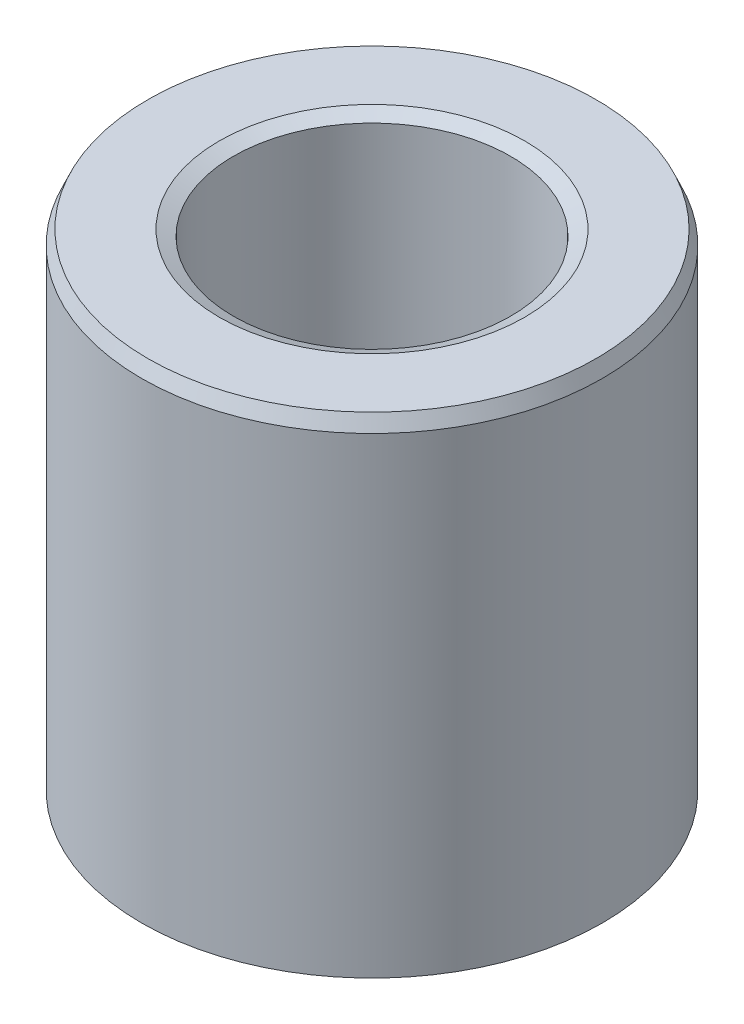
from build123d import *
from OCP.BRepFilletAPI import BRepFilletAPI_MakeChamfer

# Parameters (mm, degrees)
SKETCH1_R           = 32.5
BOSS_EXTRUDE1_DEPTH = 69.383300286
SKETCH2_R           = 19.549536357
CUT_EXTRUDE1_DEPTH  = 84.225851504
CHAMFER1_SIZE       = 1.992995294
CHAMFER1_SIZE2      = 0.874840454


with BuildPart() as part:
    # Sketch1 → Boss-Extrude1 (new body)
    with BuildSketch(Plane(origin=(0, 0, 0), x_dir=(1, 0, 0), z_dir=(0, 1, 0))):
        Circle(SKETCH1_R)
    extrude(amount=BOSS_EXTRUDE1_DEPTH)

    # Sketch2 → Cut-Extrude1 (cut, through all)
    with BuildSketch(Plane(origin=(0, 0, 0), x_dir=(1, 0, 0), z_dir=(0, 1, 0))):
        Circle(SKETCH2_R)
    extrude(amount=CUT_EXTRUDE1_DEPTH, mode=Mode.SUBTRACT)

    # Chamfer1: one chamfer whose edges measure the first distance from different faces: ONE call of the kernel's chamfer builder (chamfer() names one face for all edges)
    chamfer1_edges_1 = [part.edges().sort_by_distance(p)[0] for p in [
        (-19.549536357, 69.383300286, 0),
    ]]
    chamfer1_side_1 = [part.faces().sort_by_distance(p)[0] for p in [
        (-31.580761184, 69.383300286, 0),
    ]]
    chamfer1_edges_2 = [part.edges().sort_by_distance(p)[0] for p in [
        (-19.549536357, 0, 0),
    ]]
    chamfer1_side_2 = [part.faces().sort_by_distance(p)[0] for p in [
        (-19.549536357, 34.691650143, 0),
    ]]
    chamfer1_edges_3 = [part.edges().sort_by_distance(p)[0] for p in [
        (-32.5, 0, 0),
    ]]
    chamfer1_side_3 = [part.faces().sort_by_distance(p)[0] for p in [
        (-31.580761184, 0, 0),
    ]]
    chamfer1_edges_4 = [part.edges().sort_by_distance(p)[0] for p in [
        (-32.5, 69.383300286, 0),
    ]]
    chamfer1_side_4 = [part.faces().sort_by_distance(p)[0] for p in [
        (-32.5, 34.691650143, 0),
    ]]
    chamfer1 = BRepFilletAPI_MakeChamfer(part.part.solid().wrapped)
    for e in chamfer1_edges_1:
        chamfer1.Add(CHAMFER1_SIZE, CHAMFER1_SIZE2, e.wrapped, chamfer1_side_1[0].wrapped)  # the first distance lies on this face
    for e in chamfer1_edges_2:
        chamfer1.Add(CHAMFER1_SIZE, CHAMFER1_SIZE2, e.wrapped, chamfer1_side_2[0].wrapped)  # the first distance lies on this face
    for e in chamfer1_edges_3:
        chamfer1.Add(CHAMFER1_SIZE, CHAMFER1_SIZE2, e.wrapped, chamfer1_side_3[0].wrapped)  # the first distance lies on this face
    for e in chamfer1_edges_4:
        chamfer1.Add(CHAMFER1_SIZE, CHAMFER1_SIZE2, e.wrapped, chamfer1_side_4[0].wrapped)  # the first distance lies on this face
    add(Compound.cast(chamfer1.Shape()), mode=Mode.REPLACE)


solid = part.part
